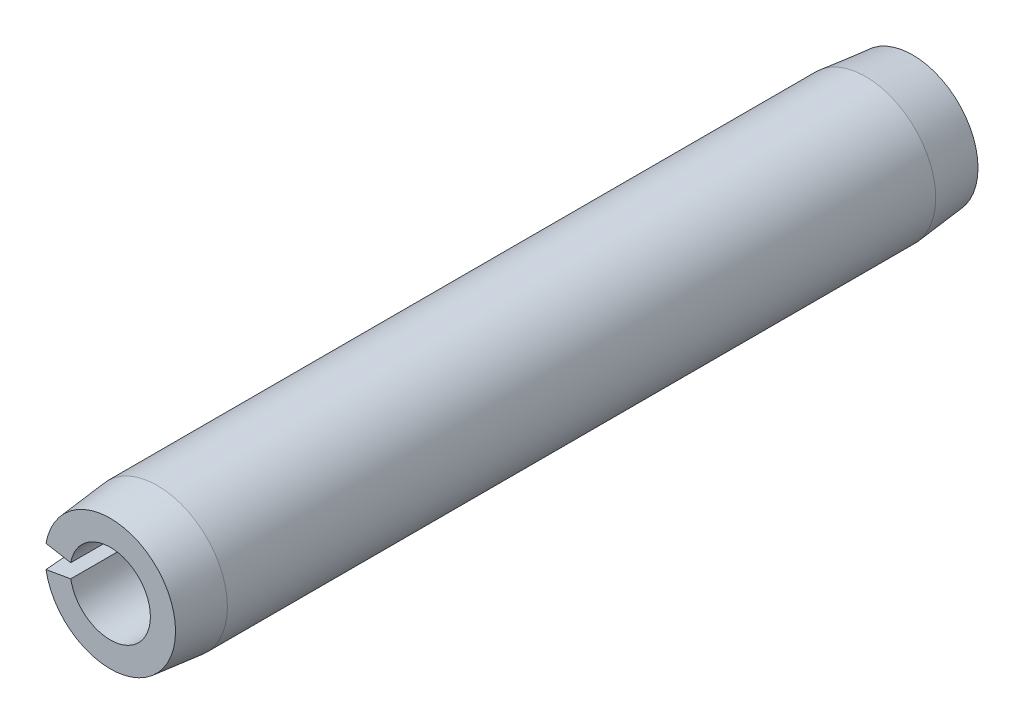
from build123d import *

# Parameters (mm, degrees)
EXTRUDE1_DEPTH = 9.525


with BuildPart() as part:
    # Sketch1 → Extrude1 (new, symmetric)
    with BuildSketch(Plane.XY):
        with BuildLine():
            Line((-1.638424659, 0.288898473), (-0.938029385, 0.165399889))
            ThreePointArc((-0.938029385, 0.165399889), (0.9525, 0), (-0.938029385, -0.165399889))
            Line((-0.938029385, -0.165399889), (-1.638424659, -0.288898473))
            ThreePointArc((-1.638424659, -0.288898473), (1.6637, 0), (-1.638424659, 0.288898473))
        make_face()
    extrude(amount=EXTRUDE1_DEPTH, both=True)

    # Sketch2 → Cut-Revolve1 (revolve, cut)
    with BuildSketch(Plane(origin=(0, 0, 0), x_dir=(0, 0, -1), z_dir=(1, 0, 0))):
        Polygon((9.525, 1.6637), (9.525, 1.5494), (8.4074, 1.6637), align=None)
        Polygon((-8.4074, 1.6637), (-9.525, 1.6637), (-9.525, 1.5494), align=None)
    revolve(axis=Axis((0, 0, -9.525), (0, 0, 1)), mode=Mode.SUBTRACT)


solid = part.part
